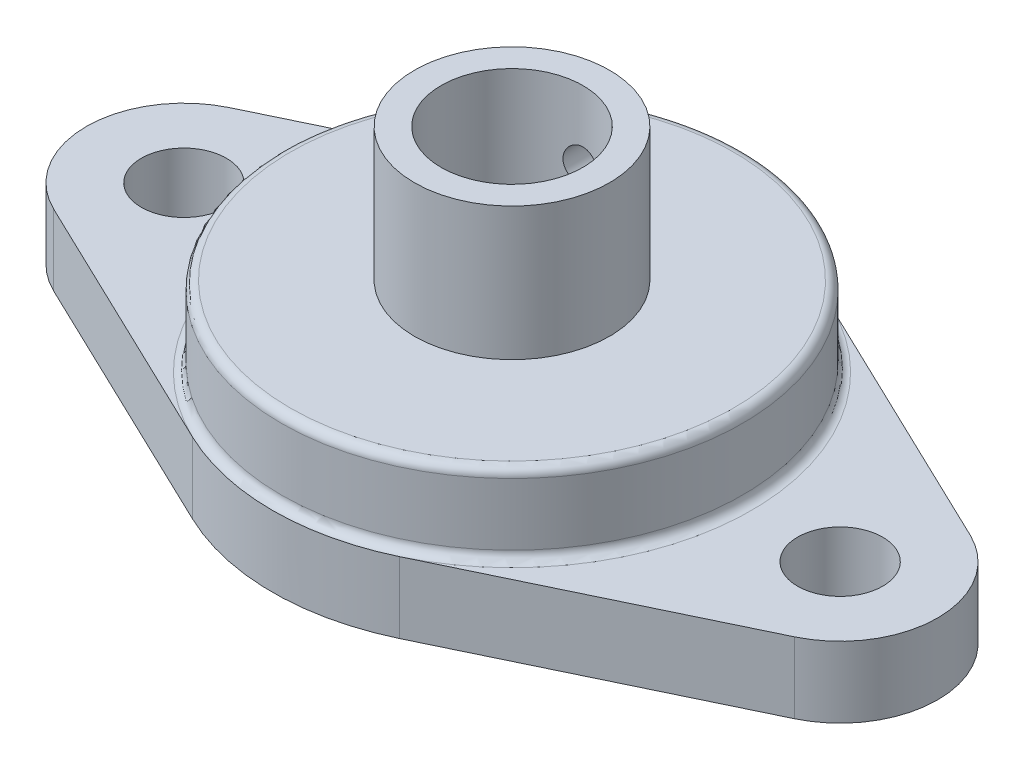
from build123d import *

# Parameters (mm, degrees)
SKETCH_1_R               = 2.4
EXTRUDE_1_DEPTH          = 4
SKETCH_2_R               = 13
EXTRUDE_2_DEPTH          = 4.5
SKETCH_3_R               = 5.5
EXTRUDE_3_DEPTH          = 7.5
CUT_EXTRUDE_1_REACH      = 33.847
SKETCH_4_R               = 4
FILLET_1_R               = 0.5
CUT_EXTRUDE_2_REACH      = 33.847
CUT_EXTRUDE_2_END_RADIUS = 5.5
SKETCH_6_R               = 1


with BuildPart() as part:
    # 草图1 → 凸台-拉伸1 (new body)
    with BuildSketch(Plane(origin=(0, 0, 0), x_dir=(1, 0, 0), z_dir=(0, 1, 0))):
        with BuildLine():
            Line((-5.837837838, 12.17249561), (-20.878378378, 4.959164878))
            ThreePointArc((-20.878378378, 4.959164878), (-24, 0), (-20.878378378, -4.959164878))
            Line((-20.878378378, -4.959164878), (-5.837837838, -12.17249561))
            ThreePointArc((-5.837837838, -12.17249561), (0, -13.5), (5.837837838, -12.17249561))
            Line((5.837837838, -12.17249561), (20.878378378, -4.959164878))
            ThreePointArc((20.878378378, -4.959164878), (24, 0), (20.878378378, 4.959164878))
            Line((20.878378378, 4.959164878), (5.837837838, 12.17249561))
            ThreePointArc((5.837837838, 12.17249561), (0, 13.5), (-5.837837838, 12.17249561))
        make_face()
        with Locations(Location((-18.5, 0, 0), (0, 0, 270))):
            Circle(SKETCH_1_R, mode=Mode.SUBTRACT)
        with Locations(Location((18.5, 0, 0), (0, 0, 270))):
            Circle(SKETCH_1_R, mode=Mode.SUBTRACT)
    extrude(amount=EXTRUDE_1_DEPTH)

    # 草图2 → 凸台-拉伸2 (add)
    with BuildSketch(Plane(origin=(0, 4, 0), x_dir=(1, 0, 0), z_dir=(0, 1, 0))):
        with Locations(Location((0, 0, 0), (0, 0, 270))):
            Circle(SKETCH_2_R)
    extrude(amount=EXTRUDE_2_DEPTH)

    # 草图3 → 凸台-拉伸3 (add)
    with BuildSketch(Plane(origin=(0, 8.5, 0), x_dir=(1, 0, 0), z_dir=(0, 1, 0))):
        with Locations(Location((0, 0, 0), (0, 0, 270))):
            Circle(SKETCH_3_R)
    extrude(amount=EXTRUDE_3_DEPTH)

    # 草图4 → 切除-拉伸1 (cut, up to next)
    with BuildSketch(Plane(origin=(0, 16, 0), x_dir=(1, 0, 0), z_dir=(0, 1, 0)), mode=Mode.PRIVATE) as cut_extrude_1_sk1:
        with Locations(Location((0, 0, 0), (0, 0, 270))):
            Circle(SKETCH_4_R)
    cut_extrude_1_tool1 = extrude(cut_extrude_1_sk1.sketch, amount=-CUT_EXTRUDE_1_REACH, mode=Mode.PRIVATE) & part.part
    add(cut_extrude_1_tool1.solids().sort_by_distance((0, 16, 0))[0], mode=Mode.SUBTRACT)

    # 圆角1
    fillet_1_edges = [part.edges().sort_by_distance(p)[0] for p in [
        (0, 4, -13),
        (0, 8.5, -13),
    ]]
    fillet(fillet_1_edges, radius=FILLET_1_R - 0.0001)  # a hair under: the kernel refuses the full size

    # 切除-拉伸2: up to this cylinder (the profile starts inside it)
    cut_extrude_2_end = Plane(origin=(0, 12, 0), z_dir=(0, -1, 0)) * Cylinder(CUT_EXTRUDE_2_END_RADIUS, 79.694, mode=Mode.PRIVATE)
    # 草图6 → 切除-拉伸2 (cut, up to the surface)
    with BuildSketch(Plane.XY, mode=Mode.PRIVATE) as cut_extrude_2_sk1:
        with Locations((0, 12)):
            Circle(SKETCH_6_R)
    cut_extrude_2_tool1 = extrude(cut_extrude_2_sk1.sketch, amount=-CUT_EXTRUDE_2_REACH, mode=Mode.PRIVATE) & cut_extrude_2_end
    add(cut_extrude_2_tool1.solids().sort_by_distance((0, 12, 0))[0], mode=Mode.SUBTRACT)


solid = part.part
